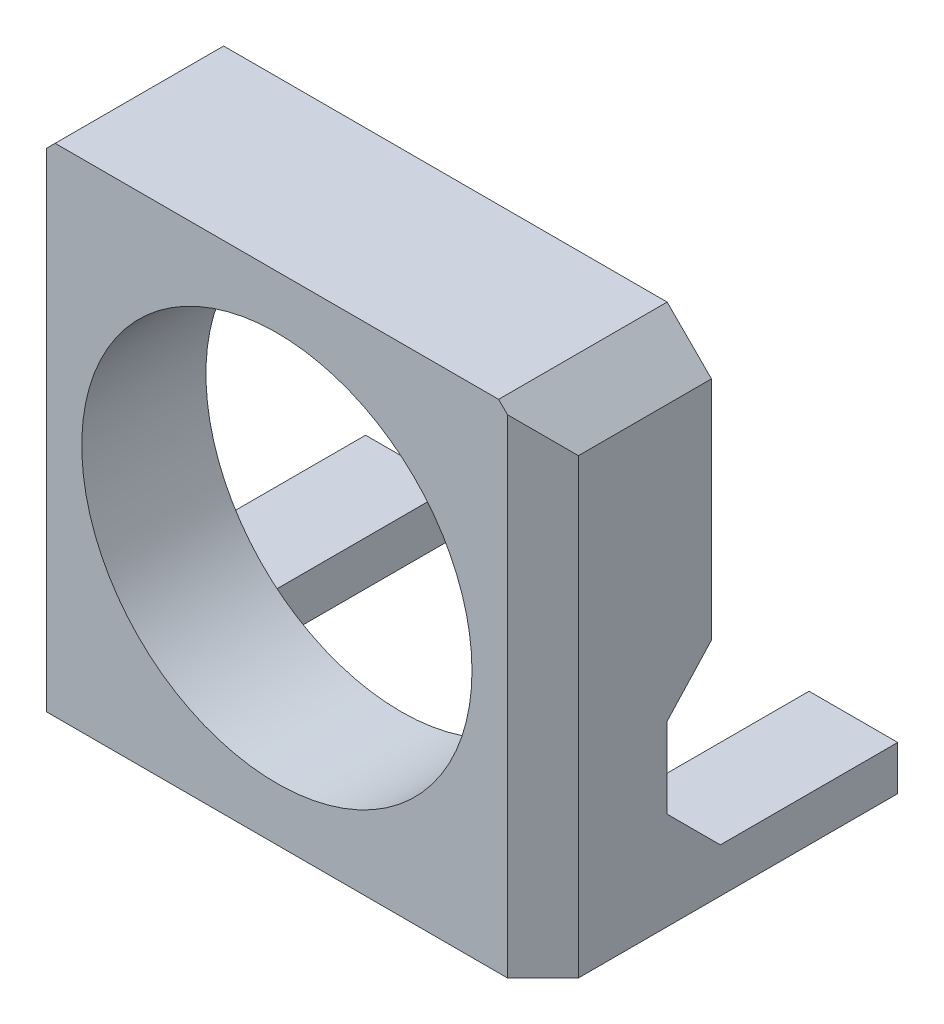
from build123d import *

# Parameters (mm, degrees)
SKETCH1_R           = 11
BOSS_EXTRUDE1_DEPTH = 7
SKETCH2_W           = 5
SKETCH2_H           = 2.5
BOSS_EXTRUDE2_DEPTH = 13
CHAMFER1_SIZE       = 3
CHAMFER2_SIZE       = 2
CHAMFER3_SIZE       = 2
CHAMFER4_SIZE       = 2
BOSS_EXTRUDE4_DEPTH = 2.5
CHAMFER6_SIZE       = 2.5


with BuildPart() as part:
    # Sketch1 → Boss-Extrude1 (new body)
    with BuildSketch(Plane.XY):
        Polygon((-15, 11.5), (-12.5, 14), (12.5, 14), (15, 11.5), (15, -14), (-15, -14), align=None)
        Circle(SKETCH1_R, mode=Mode.SUBTRACT)
    extrude(amount=BOSS_EXTRUDE1_DEPTH)

    # Sketch2 → Boss-Extrude2 (add)
    with BuildSketch(Plane(origin=(0, 0, 0), x_dir=(-1, 0, 0), z_dir=(0, 0, -1))):
        with Locations((-12.5, -12.75)):
            Rectangle(SKETCH2_W, SKETCH2_H)
        with Locations((12.5, -12.75)):
            Rectangle(SKETCH2_W, SKETCH2_H)
    extrude(amount=BOSS_EXTRUDE2_DEPTH)

    # Chamfer1
    chamfer1_edges = [part.edges().sort_by_distance(p)[0] for p in [
        (-12.5, -11.5, 0),
        (12.5, -11.5, 0),
    ]]
    chamfer(chamfer1_edges, length=CHAMFER1_SIZE)

    # Chamfer2
    chamfer2_edges = [part.edges().sort_by_distance(p)[0] for p in [
        (-10, -11.25, 0),
        (10, -11.25, 0),
    ]]
    chamfer(chamfer2_edges, length=CHAMFER2_SIZE)

    # Chamfer3
    chamfer3_edges = [part.edges().sort_by_distance(p)[0] for p in [
        (15, -1.25, 7),
    ]]
    chamfer(chamfer3_edges, length=CHAMFER3_SIZE)

    # Chamfer4
    chamfer4_edges = [part.edges().sort_by_distance(p)[0] for p in [
        (-15, -1.25, 7),
    ]]
    chamfer(chamfer4_edges, length=CHAMFER4_SIZE)

    # Sketch4 → Boss-Extrude4 (add)
    with BuildSketch(Plane(origin=(0, 0, 0), x_dir=(-1, 0, 0), z_dir=(0, 0, -1))):
        Polygon((-15, -1.25), (15, 11.5), (12.5, 14), (-12.5, 14), (-15, 11.5), align=None)
    extrude(amount=BOSS_EXTRUDE4_DEPTH)

    # Chamfer6
    # the kernel refuses this chamfer: 2.5 mm, written as the material it adds along each edge
    with BuildSketch(Plane(origin=(20.916998416, -3.764724327, 0), x_dir=(0.01075475478430782, 0.02530530537484193, -0.9996219169112968), z_dir=(-0.9203309184584746, 0.39114064034485174, 0))) as chamfer6_piece_1_section:
        Polygon((CHAMFER6_SIZE * 0.999621916911, CHAMFER6_SIZE * 0.0274958766106), (-CHAMFER6_SIZE * 0.0274958766106, CHAMFER6_SIZE * 0.999621916911), (0, 0), align=None)
    chamfer6_piece_1 = extrude(amount=17.214861222, mode=Mode.PRIVATE)
    chamfer6_piece_1 = chamfer6_piece_1 - Plane(origin=(0, 0, -0.830769879), x_dir=(1, 0, 0), z_dir=(0, 0, -1)) * Cylinder(11, 45, mode=Mode.PRIVATE)
    chamfer6_piece_1 = split(chamfer6_piece_1, bisect_by=Plane(origin=(15, -1.305255327, -0.830769879), z_dir=(-1, 0, 0)), keep=Keep.TOP, mode=Mode.PRIVATE)
    add(chamfer6_piece_1)
    with BuildSketch(Plane(origin=(-1.383846422, 5.71313473, 0), x_dir=(0.010754754784307773, 0.025305305374841817, -0.9996219169112968), z_dir=(-0.9203309184584746, 0.39114064034485174, 0))) as chamfer6_piece_2_section:
        Polygon((CHAMFER6_SIZE * 0.999621916911, CHAMFER6_SIZE * 0.0274958766106), (-CHAMFER6_SIZE * 0.0274958766106, CHAMFER6_SIZE * 0.999621916911), (0, 0), align=None)
    chamfer6_piece_2 = extrude(amount=21.224052785, mode=Mode.PRIVATE)
    chamfer6_piece_2 = chamfer6_piece_2 - Plane(origin=(0, 0, -0.851096237), x_dir=(1, 0, 0), z_dir=(0, 0, -1)) * Cylinder(11, 53, mode=Mode.PRIVATE)
    chamfer6_piece_2 = split(chamfer6_piece_2, bisect_by=Plane(origin=(-15, 9.126408424, -0.851096237), z_dir=(1, 0, 0)), keep=Keep.TOP, mode=Mode.PRIVATE)
    add(chamfer6_piece_2)


solid = part.part
